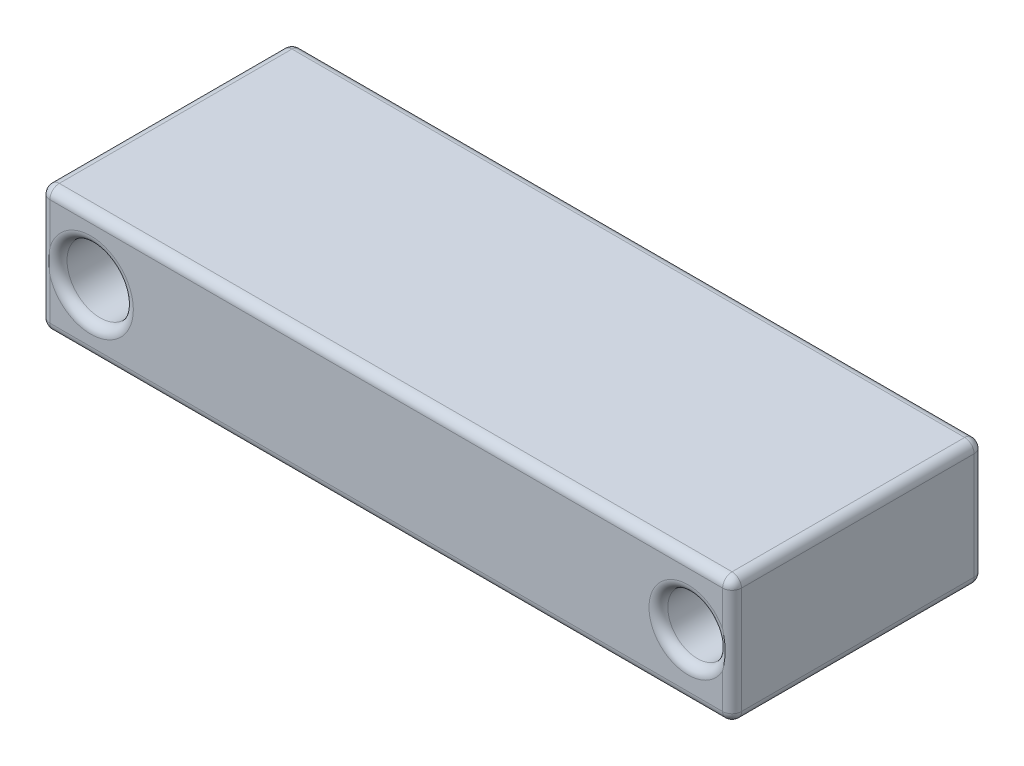
from build123d import *

# Parameters (mm, degrees)
SKETCH1_W      = 110
SKETCH1_H      = 20
EXTRUDE1_DEPTH = 40
SKETCH2_R      = 5.275032214
SKETCH2_R_2    = 4.714043742
EXTRUDE2_DEPTH = 110
FILLET1_R      = 1.5


with BuildPart() as part:
    # Sketch1 → Extrude1 (new body)
    with BuildSketch(Plane.XY):
        with Locations((-40.381896345, 45.506224595)):
            Rectangle(SKETCH1_W, SKETCH1_H)
    extrude(amount=EXTRUDE1_DEPTH)

    # Sketch2 → Extrude2 (cut)
    with BuildSketch(Plane.XY.offset(40)):
        with Locations((-87.381896345, 45.506224595)):
            Circle(SKETCH2_R)
        with Locations((7.618103655, 45.506224595)):
            Circle(SKETCH2_R_2)
    extrude(amount=-EXTRUDE2_DEPTH, mode=Mode.SUBTRACT)

    # Fillet1
    # the kernel refuses this fillet: 1.5 mm, written as the material it takes off along each edge
    with BuildSketch(Plane(origin=(13.118103655, 54.006224595, 38.5), x_dir=(1, 0, 0), z_dir=(0, 1, 0))) as fillet1_piece_1_section:
        Polygon((0, 0), (FILLET1_R, 0), (FILLET1_R, -FILLET1_R), (0, -FILLET1_R), align=None)
    fillet1_piece_1 = extrude(amount=FILLET1_R, mode=Mode.PRIVATE)
    fillet1_piece_1 = fillet1_piece_1 - Plane(origin=(13.118103655, 54.006224595, 38.5), x_dir=(-0.7071067811865475, 0, -0.7071067811865475), z_dir=(0, 1, 0)) * Sphere(FILLET1_R, mode=Mode.PRIVATE)
    add(fillet1_piece_1, mode=Mode.SUBTRACT)
    with BuildSketch(Plane(origin=(13.118103655, 37.006224595, 38.5), x_dir=(0, 0, 1), z_dir=(1, 0, 0))) as fillet1_piece_2_section:
        Polygon((0, 0), (FILLET1_R, 0), (FILLET1_R, FILLET1_R), (0, FILLET1_R), align=None)
    fillet1_piece_2 = extrude(amount=FILLET1_R, mode=Mode.PRIVATE)
    fillet1_piece_2 = fillet1_piece_2 - Plane(origin=(13.118103655, 37.006224595, 38.5), x_dir=(0, 0.7071067811865475, -0.7071067811865475), z_dir=(1, 0, 0)) * Sphere(FILLET1_R, mode=Mode.PRIVATE)
    add(fillet1_piece_2, mode=Mode.SUBTRACT)
    with BuildSketch(Plane(origin=(-93.881896345, 54.006224595, 38.5), x_dir=(-1, 0, 0), z_dir=(0, 1, 0))) as fillet1_piece_3_section:
        Polygon((0, 0), (FILLET1_R, 0), (FILLET1_R, FILLET1_R), (0, FILLET1_R), align=None)
    fillet1_piece_3 = extrude(amount=FILLET1_R, mode=Mode.PRIVATE)
    fillet1_piece_3 = fillet1_piece_3 - Plane(origin=(-93.881896345, 54.006224595, 38.5), x_dir=(0.7071067811865475, 0, -0.7071067811865475), z_dir=(0, 1, 0)) * Sphere(FILLET1_R, mode=Mode.PRIVATE)
    add(fillet1_piece_3, mode=Mode.SUBTRACT)
    with BuildSketch(Plane(origin=(-93.881896345, 37.006224595, 38.5), x_dir=(0, 0, 1), z_dir=(-1, 0, 0))) as fillet1_piece_4_section:
        Polygon((0, 0), (FILLET1_R, 0), (FILLET1_R, -FILLET1_R), (0, -FILLET1_R), align=None)
    fillet1_piece_4 = extrude(amount=FILLET1_R, mode=Mode.PRIVATE)
    fillet1_piece_4 = fillet1_piece_4 - Plane(origin=(-93.881896345, 37.006224595, 38.5), x_dir=(0, 0.7071067811865475, -0.7071067811865475), z_dir=(-1, 0, 0)) * Sphere(FILLET1_R, mode=Mode.PRIVATE)
    add(fillet1_piece_4, mode=Mode.SUBTRACT)
    with BuildSketch(Plane(origin=(-93.881896345, 54.006224595, 1.5), x_dir=(-1, 0, 0), z_dir=(0, 1, 0))) as fillet1_piece_5_section:
        Polygon((0, 0), (FILLET1_R, 0), (FILLET1_R, -FILLET1_R), (0, -FILLET1_R), align=None)
    fillet1_piece_5 = extrude(amount=FILLET1_R, mode=Mode.PRIVATE)
    fillet1_piece_5 = fillet1_piece_5 - Plane(origin=(-93.881896345, 54.006224595, 1.5), x_dir=(0.7071067811865475, 0, 0.7071067811865475), z_dir=(0, 1, 0)) * Sphere(FILLET1_R, mode=Mode.PRIVATE)
    add(fillet1_piece_5, mode=Mode.SUBTRACT)
    with BuildSketch(Plane(origin=(13.118103655, 54.006224595, 1.5), x_dir=(1, 0, 0), z_dir=(0, 1, 0))) as fillet1_piece_6_section:
        Polygon((0, 0), (FILLET1_R, 0), (FILLET1_R, FILLET1_R), (0, FILLET1_R), align=None)
    fillet1_piece_6 = extrude(amount=FILLET1_R, mode=Mode.PRIVATE)
    fillet1_piece_6 = fillet1_piece_6 - Plane(origin=(13.118103655, 54.006224595, 1.5), x_dir=(-0.7071067811865475, 0, 0.7071067811865475), z_dir=(0, 1, 0)) * Sphere(FILLET1_R, mode=Mode.PRIVATE)
    add(fillet1_piece_6, mode=Mode.SUBTRACT)
    with BuildSketch(Plane(origin=(13.118103655, 37.006224595, 1.5), x_dir=(0, 0, -1), z_dir=(1, 0, 0))) as fillet1_piece_7_section:
        Polygon((0, 0), (FILLET1_R, 0), (FILLET1_R, -FILLET1_R), (0, -FILLET1_R), align=None)
    fillet1_piece_7 = extrude(amount=FILLET1_R, mode=Mode.PRIVATE)
    fillet1_piece_7 = fillet1_piece_7 - Plane(origin=(13.118103655, 37.006224595, 1.5), x_dir=(0, 0.7071067811865475, 0.7071067811865475), z_dir=(1, 0, 0)) * Sphere(FILLET1_R, mode=Mode.PRIVATE)
    add(fillet1_piece_7, mode=Mode.SUBTRACT)
    with BuildSketch(Plane(origin=(-93.881896345, 37.006224595, 1.5), x_dir=(0, 0, -1), z_dir=(-1, 0, 0))) as fillet1_piece_8_section:
        Polygon((0, 0), (FILLET1_R, 0), (FILLET1_R, FILLET1_R), (0, FILLET1_R), align=None)
    fillet1_piece_8 = extrude(amount=FILLET1_R, mode=Mode.PRIVATE)
    fillet1_piece_8 = fillet1_piece_8 - Plane(origin=(-93.881896345, 37.006224595, 1.5), x_dir=(0, 0.7071067811865475, 0.7071067811865475), z_dir=(-1, 0, 0)) * Sphere(FILLET1_R, mode=Mode.PRIVATE)
    add(fillet1_piece_8, mode=Mode.SUBTRACT)
    with BuildSketch(Plane(origin=(14.618103655, 54.006224595, 40), x_dir=(0, 0, -1), z_dir=(0, -1, 0)), Plane(origin=(-95.381896345, 37.006224595, 40), x_dir=(0, 0, -1), z_dir=(0, 1, 0))) as fillet1_piece_9:
        with BuildLine():
            CenterArc((FILLET1_R, -FILLET1_R), FILLET1_R, 90, 90)
            Line((0, -FILLET1_R), (0, 0))
            Line((0, 0), (FILLET1_R, 0))
        make_face()
    extrude(amount=17, mode=Mode.SUBTRACT)
    with BuildSketch(Plane(origin=(-93.881896345, 55.506224595, 40), x_dir=(0, 0, -1), z_dir=(1, 0, 0)), Plane(origin=(13.118103655, 35.506224595, 0), x_dir=(0, 1, 0), z_dir=(-1, 0, 0))) as fillet1_piece_10:
        with BuildLine():
            CenterArc((FILLET1_R, -FILLET1_R), FILLET1_R, 90, 90)
            Line((0, -FILLET1_R), (0, 0))
            Line((0, 0), (FILLET1_R, 0))
        make_face()
    extrude(amount=107, mode=Mode.SUBTRACT)
    with BuildSketch(Plane(origin=(-87.381896345, 45.506224595, 0), x_dir=(1, 0, 0), z_dir=(0, -1, 0))) as fillet1_piece_11:
        with BuildLine():
            CenterArc((5.275032214 + FILLET1_R, FILLET1_R), FILLET1_R, 180, 90)
            Line((5.275032214, FILLET1_R), (5.275032214, 0))
            Line((5.275032214, 0), (5.275032214 + FILLET1_R, 0))
        make_face()
    revolve(axis=Axis((-87.381896345, 45.506224595, 0), (0, 0, 1)), mode=Mode.SUBTRACT)
    with BuildSketch(Plane(origin=(-87.381896345, 45.506224595, 40), x_dir=(1, 0, 0), z_dir=(0, -1, 0))) as fillet1_piece_12:
        with BuildLine():
            CenterArc((5.275032214 + FILLET1_R, -FILLET1_R), FILLET1_R, 90, 90)
            Line((5.275032214, -FILLET1_R), (5.275032214, 0))
            Line((5.275032214, 0), (5.275032214 + FILLET1_R, 0))
        make_face()
    revolve(axis=Axis((-87.381896345, 45.506224595, 40), (0, 0, 1)), mode=Mode.SUBTRACT)
    with BuildSketch(Plane(origin=(7.618103655, 45.506224595, 0), x_dir=(1, 0, 0), z_dir=(0, -1, 0))) as fillet1_piece_13:
        with BuildLine():
            CenterArc((4.714043742 + FILLET1_R, FILLET1_R), FILLET1_R, 180, 90)
            Line((4.714043742, FILLET1_R), (4.714043742, 0))
            Line((4.714043742, 0), (4.714043742 + FILLET1_R, 0))
        make_face()
    revolve(axis=Axis((7.618103655, 45.506224595, 0), (0, 0, 1)), mode=Mode.SUBTRACT)
    with BuildSketch(Plane(origin=(7.618103655, 45.506224595, 40), x_dir=(1, 0, 0), z_dir=(0, -1, 0))) as fillet1_piece_14:
        with BuildLine():
            CenterArc((4.714043742 + FILLET1_R, -FILLET1_R), FILLET1_R, 90, 90)
            Line((4.714043742, -FILLET1_R), (4.714043742, 0))
            Line((4.714043742, 0), (4.714043742 + FILLET1_R, 0))
        make_face()
    revolve(axis=Axis((7.618103655, 45.506224595, 40), (0, 0, 1)), mode=Mode.SUBTRACT)
    with BuildSketch(Plane(origin=(-93.881896345, 55.506224595, 0), x_dir=(0, 0, 1), z_dir=(1, 0, 0)), Plane(origin=(13.118103655, 35.506224595, 40), x_dir=(0, 1, 0), z_dir=(-1, 0, 0))) as fillet1_piece_15:
        with BuildLine():
            CenterArc((FILLET1_R, FILLET1_R), FILLET1_R, 180, 90)
            Line((0, FILLET1_R), (0, 0))
            Line((0, 0), (FILLET1_R, 0))
        make_face()
    extrude(amount=107, mode=Mode.SUBTRACT)
    with BuildSketch(Plane(origin=(14.618103655, 54.006224595, 0), x_dir=(0, 0, 1), z_dir=(0, -1, 0)), Plane(origin=(-95.381896345, 37.006224595, 0), x_dir=(0, 0, 1), z_dir=(0, 1, 0))) as fillet1_piece_16:
        with BuildLine():
            CenterArc((FILLET1_R, FILLET1_R), FILLET1_R, 180, 90)
            Line((0, FILLET1_R), (0, 0))
            Line((0, 0), (FILLET1_R, 0))
        make_face()
    extrude(amount=17, mode=Mode.SUBTRACT)
    with BuildSketch(Plane(origin=(-95.381896345, 55.506224595, 1.5), x_dir=(1, 0, 0), z_dir=(0, 0, 1)), Plane(origin=(-95.381896345, 35.506224595, 1.5), x_dir=(0, 1, 0), z_dir=(0, 0, 1))) as fillet1_piece_17:
        with BuildLine():
            CenterArc((FILLET1_R, -FILLET1_R), FILLET1_R, 90, 90)
            Line((0, -FILLET1_R), (0, 0))
            Line((0, 0), (FILLET1_R, 0))
        make_face()
    extrude(amount=37, mode=Mode.SUBTRACT)
    with BuildSketch(Plane(origin=(14.618103655, 55.506224595, 1.5), x_dir=(-1, 0, 0), z_dir=(0, 0, 1)), Plane(origin=(14.618103655, 35.506224595, 1.5), x_dir=(0, 1, 0), z_dir=(0, 0, 1))) as fillet1_piece_18:
        with BuildLine():
            CenterArc((FILLET1_R, FILLET1_R), FILLET1_R, 180, 90)
            Line((0, FILLET1_R), (0, 0))
            Line((0, 0), (FILLET1_R, 0))
        make_face()
    extrude(amount=37, mode=Mode.SUBTRACT)


solid = part.part
